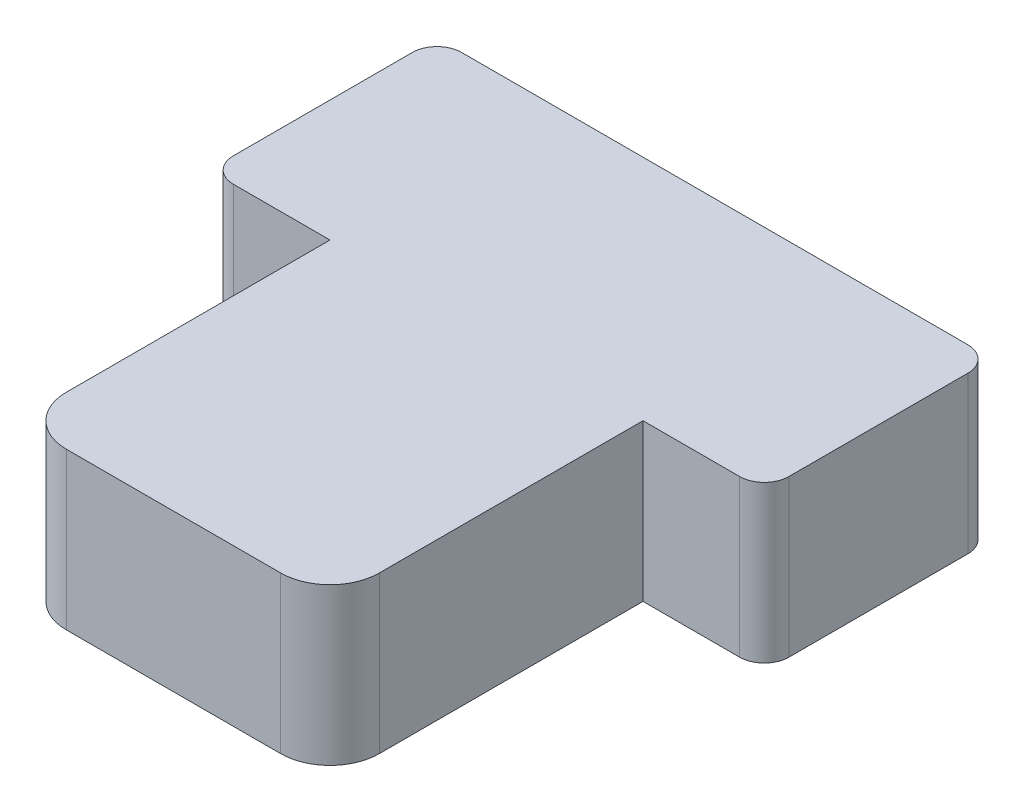
from build123d import *

# Parameters (mm, degrees)
MOTORSUPPORT_EXTRUDE_DEPTH  = 3.175
MOTORSUPPORT_BOTTOMFILLET_R = 1
MOTORSUPPORT_TOPFILLET_R    = 0.5


with BuildPart() as part:
    # Sketch1 → MotorSupport_Extrude (new body)
    with BuildSketch(Plane(origin=(0, 0, 0), x_dir=(1, 0, 0), z_dir=(0, 1, 0))):
        Polygon((0, 0), (6.35, 0), (6.35, 6.35), (8.81, 6.35), (8.81, 10.9807274), (-2.46, 10.9807274), (-2.46, 6.35), (0, 6.35), align=None)
    extrude(amount=MOTORSUPPORT_EXTRUDE_DEPTH)

    # MotorSupport_BottomFillet
    motorsupport_bottomfillet_edges = [part.edges().sort_by_distance(p)[0] for p in [
        (0, 1.5875, 0),
        (6.35, 1.5875, 0),
    ]]
    fillet(motorsupport_bottomfillet_edges, radius=MOTORSUPPORT_BOTTOMFILLET_R)

    # MotorSupport_TopFillet
    motorsupport_topfillet_edges = [part.edges().sort_by_distance(p)[0] for p in [
        (-2.46, 1.5875, -6.35),
        (-2.46, 1.5875, -10.9807274),
        (8.81, 1.5875, -10.9807274),
        (8.81, 1.5875, -6.35),
    ]]
    fillet(motorsupport_topfillet_edges, radius=MOTORSUPPORT_TOPFILLET_R)


solid = part.part
